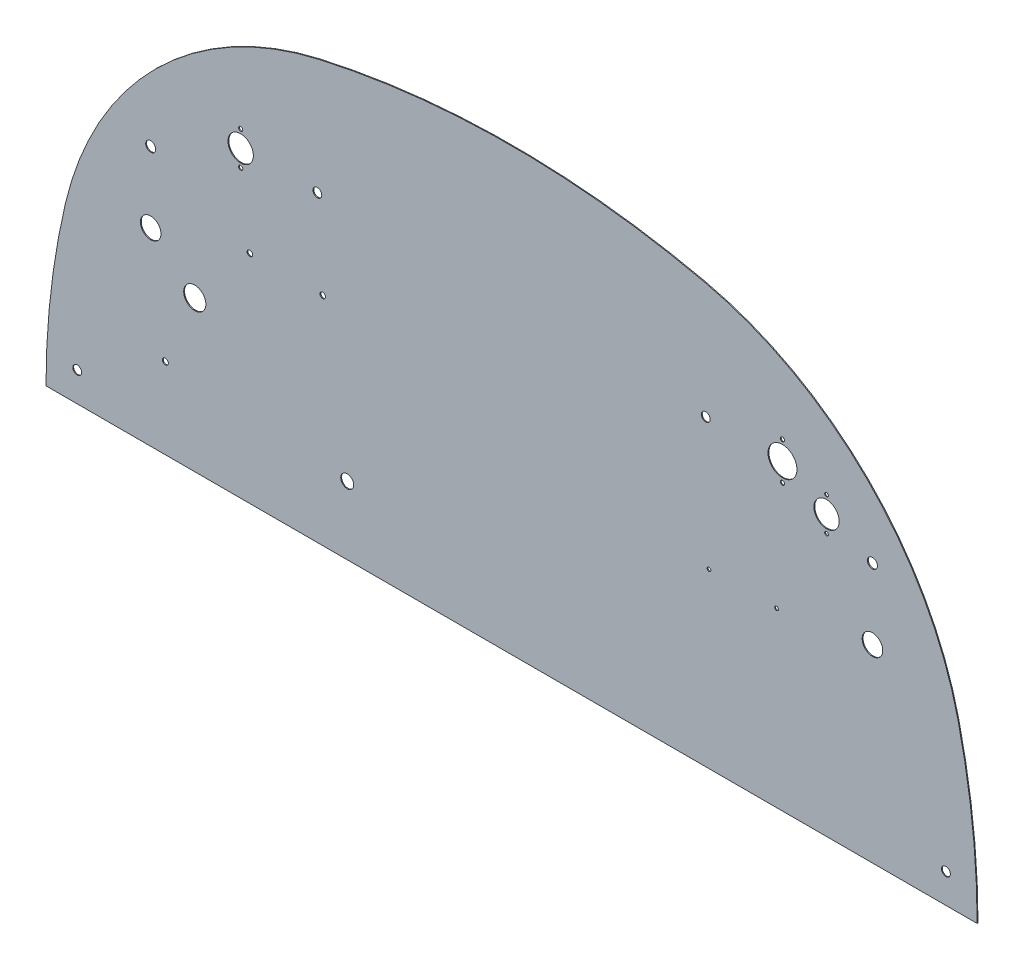
from build123d import *

# Parameters (mm, degrees)
BASE_SKETCH_R                              = 3.81
BASE_W_MOUNT_HOLES_DEPTH                   = 0.7366
THROTTLE_AND_CHOKE_CUTOUT_SKETCH_R         = 8.89
THROTTLE_AND_CHOKE_CUTOUT_SKETCH_R_2       = 4.318
THROTTLE_AND_CHOKE_CUTOUTS_DEPTH           = 856.301945634
STARTER_RELAY_MOUNT_SKETCH_R               = 2.38125
STARTER_RELAY_MOUNT_DEPTH                  = 856.301945634
OIL_PRESSURE_SENDER_CLAMP_MOUNT_SKETCH_R   = 2.54
OIL_PRESSURE_SENDER_CLAMP_MOUNT_DEPTH      = 856.301945634
STARTER_POWER_CUTOUT_SKETCH_R              = 5.588
STARTER_POWER_CUTOUT_DEPTH                 = 856.301945634
FUEL_RETURN_CUTOUT_SKETCH_R                = 9.5758
FUEL_RETURN_CUTOUT_DEPTH                   = 856.301945634
BRAKE_MASTER_CYL_MOUNT_SKETCH_R            = 1.6256
BRAKE_MASTER_CYL_MOUNT_DEPTH               = 856.301945634
CUTOUT_AS012_INSTRUMENTATION_RIGHT_S_R     = 10.94994
CUTOUT_AS012_INSTRUMENTATION_RIGHT_S_R_2   = 1.8034
CUTOUT_AS012_INSTRUMENTATION_RIGHT_DEPTH   = 856.301945634
CUTOUT_AS014_TACH_AND_CDI_ENABLE_2_R       = 12.4968
CUTOUT_AS014_TACH_AND_CDI_ENABLE_2_R_2     = 1.8034
CUTOUT_AS014_TACH_AND_CDI_ENABLES_LE_DEPTH = 856.301945634
CUTOUT_AS012_INSTRUMENTATION_LEFT_SK_R     = 10.94994
CUTOUT_AS012_INSTRUMENTATION_LEFT_SK_R_2   = 1.6002
CUTOUT_AS012_INSTRUMENTATION_LEFT_DEPTH    = 856.301945634


with BuildPart() as part:
    # Base Sketch → Base w Mount Holes (new body)
    with BuildSketch(Plane.XY):
        with BuildLine():
            ThreePointArc((-10.277113366, 119.316806222), (-22.796070205, 47.439191073), (-26.9875, -25.4))
            Line((-26.9875, -25.4), (777.875, -25.4))
            ThreePointArc((777.875, -25.4), (773.683570205, 47.439191073), (761.164613366, 119.316806222))
            ThreePointArc((761.164613366, 119.316806222), (682.785171377, 259.617967861), (541.922831328, 336.984330316))
            ThreePointArc((541.922831328, 336.984330316), (375.44375, 355.6), (208.964668672, 336.984330316))
            ThreePointArc((208.964668672, 336.984330316), (68.102328623, 259.617967861), (-10.277113366, 119.316806222))
        make_face()
        Circle(BASE_SKETCH_R, mode=Mode.SUBTRACT)
        with Locations((750.8875, 0)):
            Circle(BASE_SKETCH_R, mode=Mode.SUBTRACT)
        with Locations((207.565625, 236.5375)):
            Circle(BASE_SKETCH_R, mode=Mode.SUBTRACT)
        with Locations((543.321875, 236.5375)):
            Circle(BASE_SKETCH_R, mode=Mode.SUBTRACT)
    extrude(amount=BASE_W_MOUNT_HOLES_DEPTH)

    # Throttle and Choke Cutout Sketch → Throttle and Choke Cutouts (cut, through all)
    with BuildSketch(Plane.XY.offset(0.7366)):
        with Locations((63.5, 138.1125)):
            Circle(THROTTLE_AND_CHOKE_CUTOUT_SKETCH_R)
        with Locations((63.5, 199.0725)):
            Circle(THROTTLE_AND_CHOKE_CUTOUT_SKETCH_R_2)
        with Locations((687.3875, 199.0725)):
            Circle(THROTTLE_AND_CHOKE_CUTOUT_SKETCH_R_2)
        with Locations((687.3875, 138.1125)):
            Circle(THROTTLE_AND_CHOKE_CUTOUT_SKETCH_R)
    extrude(amount=-THROTTLE_AND_CHOKE_CUTOUTS_DEPTH, mode=Mode.SUBTRACT)

    # Starter Relay Mount Sketch → Starter Relay Mount (cut, through all)
    with BuildSketch(Plane.XY.offset(0.7366)):
        with Locations((149.225, 161.925)):
            Circle(STARTER_RELAY_MOUNT_SKETCH_R)
        with Locations((212.217, 161.925)):
            Circle(STARTER_RELAY_MOUNT_SKETCH_R)
    extrude(amount=-STARTER_RELAY_MOUNT_DEPTH, mode=Mode.SUBTRACT)

    # Oil Pressure Sender Clamp Mount Sketch → Oil Pressure Sender Clamp Mount (cut, through all)
    with BuildSketch(Plane.XY.offset(0.7366)):
        with Locations((76.2, 44.45)):
            Circle(OIL_PRESSURE_SENDER_CLAMP_MOUNT_SKETCH_R)
    extrude(amount=-OIL_PRESSURE_SENDER_CLAMP_MOUNT_DEPTH, mode=Mode.SUBTRACT)

    # Starter Power Cutout Sketch → Starter Power Cutout (cut, through all)
    with BuildSketch(Plane.XY.offset(0.7366)):
        with Locations((233.3625, 33.3375)):
            Circle(STARTER_POWER_CUTOUT_SKETCH_R)
    extrude(amount=-STARTER_POWER_CUTOUT_DEPTH, mode=Mode.SUBTRACT)

    # Fuel Return Cutout Sketch → Fuel Return Cutout (cut, through all)
    with BuildSketch(Plane.XY.offset(0.7366)):
        with Locations((101.6, 104.775)):
            Circle(FUEL_RETURN_CUTOUT_SKETCH_R)
    extrude(amount=-FUEL_RETURN_CUTOUT_DEPTH, mode=Mode.SUBTRACT)

    # Brake Master Cyl Mount Sketch → Brake Master Cyl Mount (cut, through all)
    with BuildSketch(Plane.XY.offset(0.7366)):
        with Locations((546.1, 123.825)):
            Circle(BRAKE_MASTER_CYL_MOUNT_SKETCH_R)
        with Locations((604.52, 123.825)):
            Circle(BRAKE_MASTER_CYL_MOUNT_SKETCH_R)
    extrude(amount=-BRAKE_MASTER_CYL_MOUNT_DEPTH, mode=Mode.SUBTRACT)

    # Cutout - AS012 - Instrumentation Right Sketch → Cutout - AS012 - Instrumentation Right (cut, through all)
    with BuildSketch(Plane.XY.offset(0.7366)):
        with Locations((141.2875, 236.5375)):
            Circle(CUTOUT_AS012_INSTRUMENTATION_RIGHT_S_R)
        with Locations((141.2875, 221.98711)):
            Circle(CUTOUT_AS012_INSTRUMENTATION_RIGHT_S_R_2)
        with Locations((141.2875, 251.08789)):
            Circle(CUTOUT_AS012_INSTRUMENTATION_RIGHT_S_R_2)
    extrude(amount=-CUTOUT_AS012_INSTRUMENTATION_RIGHT_DEPTH, mode=Mode.SUBTRACT)

    # Cutout - AS014 - Tach and CDI Enable 2 → Cutout - AS014 - Tach and CDI Enables Le (cut, through all)
    with BuildSketch(Plane.XY.offset(0.7366)):
        with Locations((609.6, 236.5375)):
            Circle(CUTOUT_AS014_TACH_AND_CDI_ENABLE_2_R)
        with Locations((609.6, 252.78715)):
            Circle(CUTOUT_AS014_TACH_AND_CDI_ENABLE_2_R_2)
        with Locations((609.6, 220.28785)):
            Circle(CUTOUT_AS014_TACH_AND_CDI_ENABLE_2_R_2)
    extrude(amount=-CUTOUT_AS014_TACH_AND_CDI_ENABLES_LE_DEPTH, mode=Mode.SUBTRACT)

    # Cutout - AS012 - Instrumentation Left Sketch → Cutout - AS012 - Instrumentation Left (cut, through all)
    with BuildSketch(Plane.XY.offset(0.7366)):
        with Locations((647.7, 215.9)):
            Circle(CUTOUT_AS012_INSTRUMENTATION_LEFT_SK_R)
        with Locations((647.7, 230.45039)):
            Circle(CUTOUT_AS012_INSTRUMENTATION_LEFT_SK_R_2)
        with Locations((647.7, 201.34961)):
            Circle(CUTOUT_AS012_INSTRUMENTATION_LEFT_SK_R_2)
    extrude(amount=-CUTOUT_AS012_INSTRUMENTATION_LEFT_DEPTH, mode=Mode.SUBTRACT)


solid = part.part
